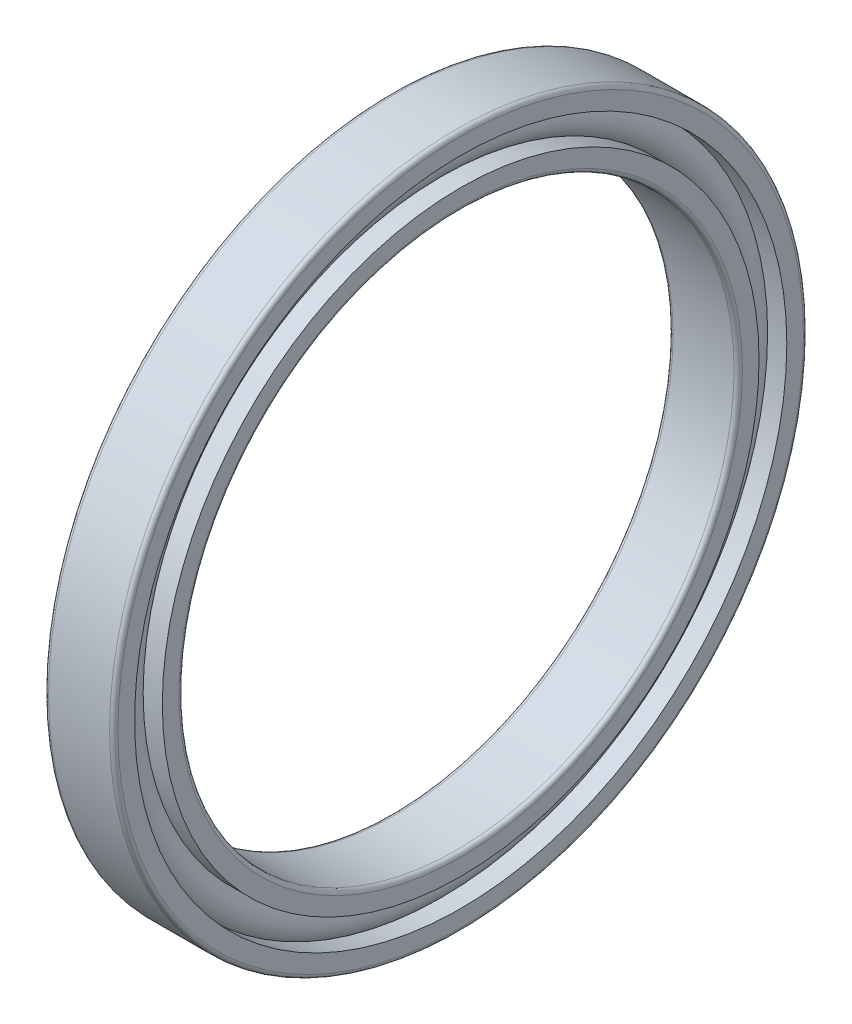
from build123d import *

# Parameters (mm, degrees)
CAGSPISKE_W     = 0.6
CAGSPISKE_H     = 1
CAGESPINE_ANGLE = 0.001
BALSIMSKE_R     = 3


with BuildPart() as part:
    # CagSpiSke → CageSpine (revolve)
    with BuildSketch(Plane.XY):
        with Locations((0, 45)):
            Rectangle(CAGSPISKE_W, CAGSPISKE_H)
    revolve(axis=Axis((-20.6375, 0, 0), (-1, 0, 0)), revolution_arc=CAGESPINE_ANGLE)

    # BalSimSke → BallsSimplified (revolve)
    with BuildSketch(Plane.XY):
        with Locations((0, 45)):
            Circle(BALSIMSKE_R)
    revolve(axis=Axis((-10, 0, 0), (1, 0, 0)))

    # InnRacSke → InnerRace (revolve)
    with BuildSketch(Plane.XY):
        with BuildLine():
            Line((-2.202413449, 43), (-5, 43))
            Line((-5, 43), (-5, 40.6))
            ThreePointArc((-5, 40.6), (-4.824264069, 40.175735931), (-4.4, 40))
            Line((-4.4, 40), (4.4, 40))
            ThreePointArc((4.4, 40), (4.824264069, 40.175735931), (5, 40.6))
            Line((5, 40.6), (5, 43))
            Line((5, 43), (2.202413449, 43))
            ThreePointArc((2.202413449, 43), (0, 42.025), (-2.202413449, 43))
        make_face()
    revolve(axis=Axis((-20.6375, 0, 0), (1, 0, 0)))

    # OutRacSke → OuterRace (revolve)
    with BuildSketch(Plane.XY):
        with BuildLine():
            Line((-2.202413449, 47), (-5, 47))
            Line((-5, 47), (-5, 49.4))
            ThreePointArc((-5, 49.4), (-4.824264069, 49.824264069), (-4.4, 50))
            Line((-4.4, 50), (4.4, 50))
            ThreePointArc((4.4, 50), (4.824264069, 49.824264069), (5, 49.4))
            Line((5, 49.4), (5, 47))
            Line((5, 47), (2.202413449, 47))
            ThreePointArc((2.202413449, 47), (0, 47.975), (-2.202413449, 47))
        make_face()
    revolve(axis=Axis((-20.6375, 0, 0), (1, 0, 0)))


solid = part.part
